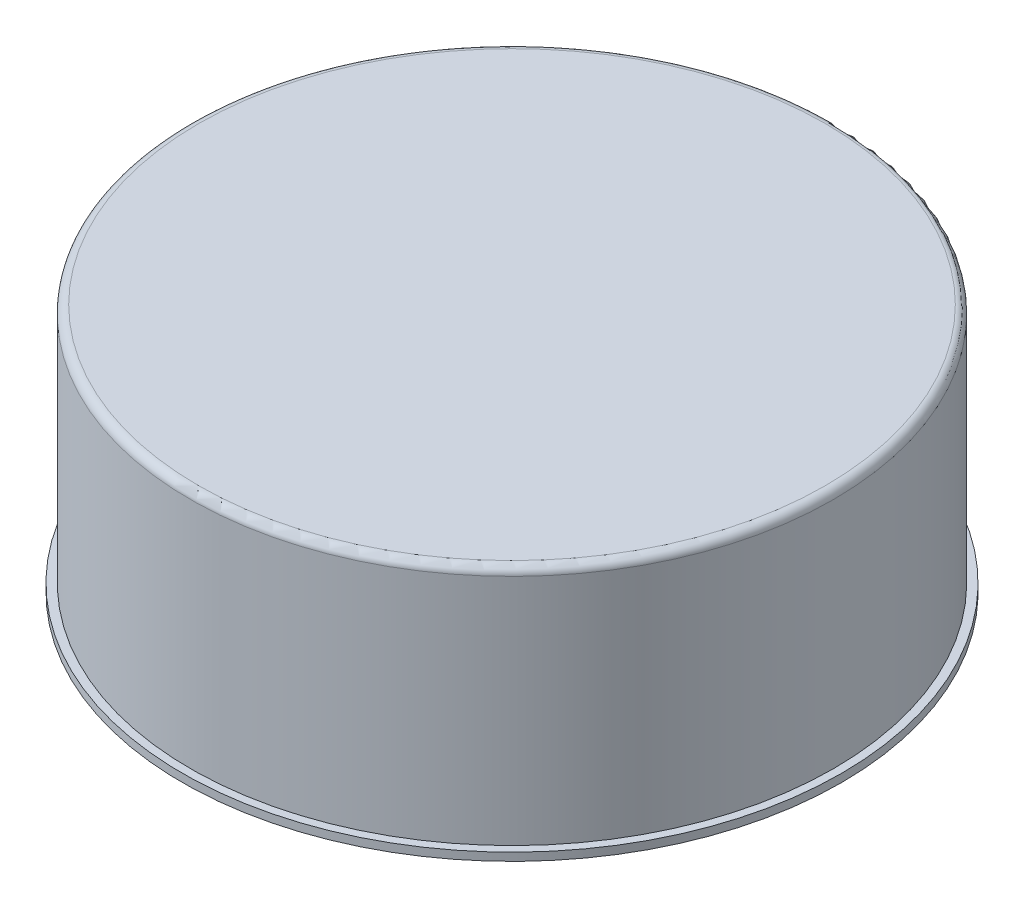
from build123d import *

# Parameters (mm, degrees)
THICKEN1_T2 = 100


with BuildPart() as body_1:
    # Surface-Revolve2: a surface, the sketch's curves turned about an axis
    with BuildLine(Plane.XY, mode=Mode.PRIVATE) as surface_revolve2_1_path:
        Line((0, 3000), (3900, 3000))
        ThreePointArc((3900, 3000), (3970.710678119, 2970.710678119), (4000, 2900))
        Line((4000, 2900), (4000, 0))
        Line((4000, 0), (4100, 0))
    surface_revolve2_1 = Shell.revolve(surface_revolve2_1_path.wire(), 360, Axis((0, 3000, 0), (0, -1, 0)))
    add(Solid.thicken(surface_revolve2_1, -THICKEN1_T2))


solid = body_1.part
